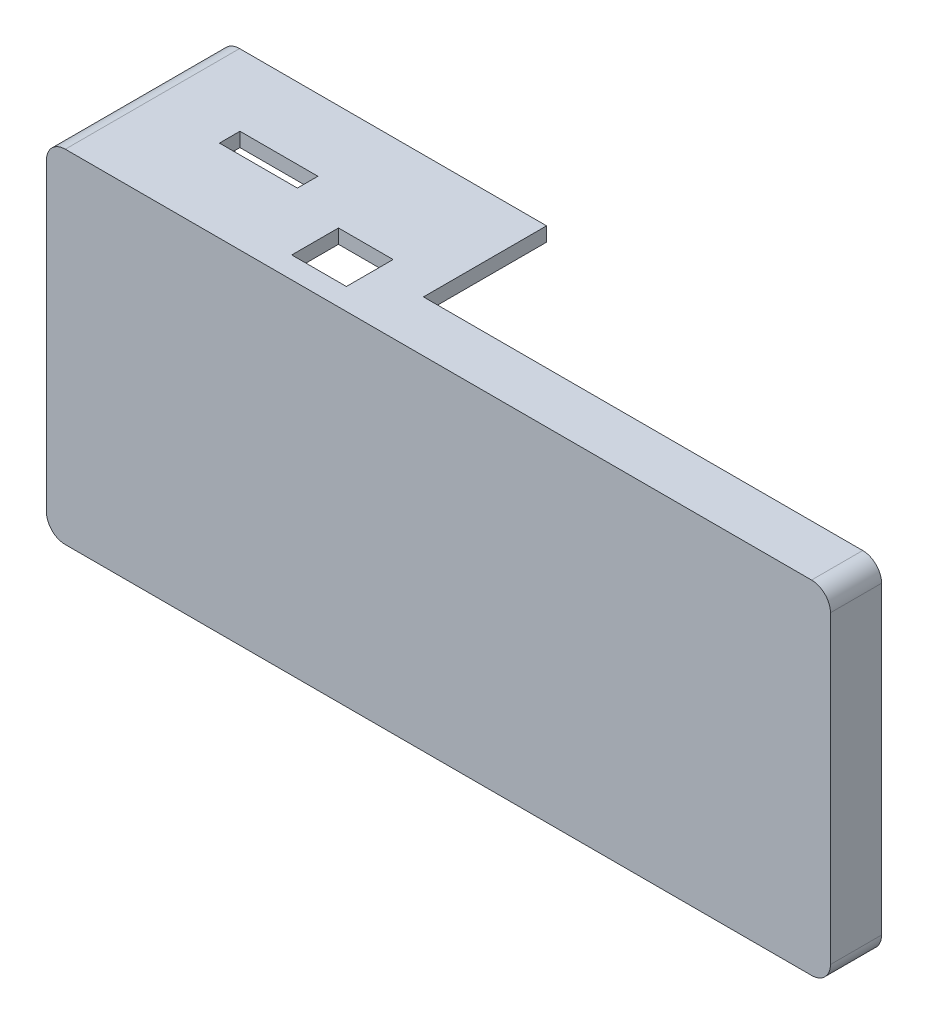
from build123d import *

# Parameters (mm, degrees)
ESQUISSE1_W                  = 160
ESQUISSE1_H                  = 66.5
BOSS_EXTRU_1_DEPTH           = 3
ESQUISSE3_W                  = 3
ESQUISSE3_H                  = 70.75
BOSS_EXTRU_2_DEPTH           = 33
ESQUISSE5_W                  = 166
ESQUISSE5_H                  = 33
ESQUISSE5_W_2                = 11.569169734
ESQUISSE5_H_2                = 9.894756015
BOSS_EXTRU_3_DEPTH           = 3
ENL_V_MAT_EXTRU_1_DEPTH      = 500
ENL_V_MAT_EXTRU_1_DEPTH_BACK = 13
ESQUISSE6_W                  = 33
ESQUISSE6_H                  = 1.25
CONG_2_R                     = 4
ESQUISSE7_W                  = 98.078954594
ESQUISSE7_H                  = 17.67
ENL_V_MAT_EXTRU_2_DEPTH      = 103
ESQUISSE8_R                  = 3.75
ENL_V_MAT_EXTRU_3_DEPTH      = 60
ESQUISSE9_W                  = 103.919717687
ESQUISSE9_H                  = 4.5
ENL_V_MAT_EXTRU_4_DEPTH      = 90
ESQUISSE11_W                 = 11.569169734
ESQUISSE11_H                 = 9.894756015
BOSS_EXTRU_4_DEPTH           = 3
D_PLACER_START               = -33.9
D_PLACER_LA_FACE2_DEPTH      = 3.9
ESQUISSE13_W                 = 16.502074088
ESQUISSE13_H                 = 4.3431
ENL_V_MAT_EXTRU_5_DEPTH      = 10
ESQUISSE15_W                 = 9.760998185
ESQUISSE15_H                 = 7
ENL_V_MAT_EXTRU_6_DEPTH      = 10


# Read off the part's stored shape, not the designer's step: Déplacer la face2
with BuildPart() as part:
    # Esquisse1 → Boss.-Extru.1 (new body)
    with BuildSketch(Plane.XY):
        Rectangle(ESQUISSE1_W, ESQUISSE1_H)
    extrude(amount=BOSS_EXTRU_1_DEPTH)

    # Esquisse3 → Boss.-Extru.2 (add)
    with BuildSketch(Plane.XY.offset(3)):
        with Locations((-81.5, -2.125)):
            Rectangle(ESQUISSE3_W, ESQUISSE3_H)
    boss_extru_2 = extrude(amount=-BOSS_EXTRU_2_DEPTH)

    # Symétrie1: Boss.-Extru.2 across plane
    add(boss_extru_2.mirror(Plane(origin=(0, 0, 0), x_dir=(0, 0, 1), z_dir=(1, 0, 0))))

    # Esquisse5 → Boss.-Extru.3 (add)
    with BuildSketch(Plane(origin=(0, 33.25, 0), x_dir=(1, 0, 0), z_dir=(0, 1, 0))):
        with Locations((0, 13.5)):
            Rectangle(ESQUISSE5_W, ESQUISSE5_H)
        with Locations((-29.852297111, 6.527378008)):
            Rectangle(ESQUISSE5_W_2, ESQUISSE5_H_2, mode=Mode.SUBTRACT)
    boss_extru_3 = extrude(amount=BOSS_EXTRU_3_DEPTH)

    # Symétrie2: Boss.-Extru.3 across plane
    add(boss_extru_3.mirror(Plane(origin=(0, 0, 0), x_dir=(0, 0, 1), z_dir=(0, -1, 0))))

    # Esquisse6 → Enlèv. mat.-Extru.1 (cut, two sides: drawn at the far end of the back side and taken through both)
    with BuildSketch(Plane.ZY.offset(-80).offset(-ENL_V_MAT_EXTRU_1_DEPTH_BACK)):
        with Locations((-13.5, -36.875)):
            Rectangle(ESQUISSE6_W, ESQUISSE6_H)
    extrude(amount=ENL_V_MAT_EXTRU_1_DEPTH + ENL_V_MAT_EXTRU_1_DEPTH_BACK, mode=Mode.SUBTRACT)

    # Congé2
    cong_2_edges = [part.edges().sort_by_distance(p)[0] for p in [
        (-83, -36.25, -13.5),
        (83, -36.25, -13.5),
        (-83, 36.25, -13.5),
        (83, 36.25, -13.5),
    ]]
    fillet(cong_2_edges, radius=CONG_2_R)

    # Esquisse7 → Enlèv. mat.-Extru.2 (cut)
    with BuildSketch(Plane(origin=(0, 36.25, 0), x_dir=(1, 0, 0), z_dir=(0, 1, 0))):
        with Locations((35.039477297, 21.165)):
            Rectangle(ESQUISSE7_W, ESQUISSE7_H)
    extrude(amount=-ENL_V_MAT_EXTRU_2_DEPTH, mode=Mode.SUBTRACT)

    # Esquisse8 → Enlèv. mat.-Extru.3 (cut)
    with BuildSketch(Plane.ZY.offset(83)):
        with Locations(Location((-23.114912873, -22.364838355, 0), (0, 0, 270))):
            Circle(ESQUISSE8_R)
        with Locations(Location((-23.117764577, 1.001660884, 0), (0, 0, 270))):
            Circle(ESQUISSE8_R)
    extrude(amount=-ENL_V_MAT_EXTRU_3_DEPTH, mode=Mode.SUBTRACT)

    # Esquisse9 → Enlèv. mat.-Extru.4 (cut)
    with BuildSketch(Plane(origin=(0, 36.25, 0), x_dir=(1, 0, 0), z_dir=(0, 1, 0))):
        with Locations((37.959858844, 10.08)):
            Rectangle(ESQUISSE9_W, ESQUISSE9_H)
    extrude(amount=-ENL_V_MAT_EXTRU_4_DEPTH, mode=Mode.SUBTRACT)

    # Esquisse11 → Boss.-Extru.4 (add)
    with BuildSketch(Plane.XZ.offset(36.25)):
        with Locations((-29.852297111, -6.527378008)):
            Rectangle(ESQUISSE11_W, ESQUISSE11_H)
    extrude(amount=-BOSS_EXTRU_4_DEPTH)

    # Déplacer la face2 outline → Déplacer la face2 (add)
    with BuildSketch(Plane.XY.offset(D_PLACER_START)):
        with BuildLine():
            ThreePointArc((-79, 36.25), (-81.828427125, 35.078427125), (-83, 32.25))
            Line((-83, 32.25), (-83, -32.25))
            ThreePointArc((-83, -32.25), (-81.828427125, -35.078427125), (-79, -36.25))
            Line((-79, -36.25), (-14, -36.25))
            Line((-14, -36.25), (-14, -33.25))
            Line((-14, -33.25), (-80, -33.25))
            Line((-80, -33.25), (-80, 33.25))
            Line((-80, 33.25), (-14, 33.25))
            Line((-14, 33.25), (-14, 36.25))
            Line((-14, 36.25), (-79, 36.25))
        make_face()
    extrude(amount=D_PLACER_LA_FACE2_DEPTH)

    # Esquisse13 → Enlèv. mat.-Extru.5 (cut)
    with BuildSketch(Plane(origin=(0, 36.25, 0), x_dir=(1, 0, 0), z_dir=(0, 1, 0))):
        with Locations((-55.551088515, 16.608317679)):
            Rectangle(ESQUISSE13_W, ESQUISSE13_H)
    extrude(amount=-ENL_V_MAT_EXTRU_5_DEPTH, mode=Mode.SUBTRACT)

    # Esquisse15 → Enlèv. mat.-Extru.6 (cut)
    with BuildSketch(Plane.XZ.offset(36.25)):
        with Locations((-66.304513779, -4.593344901)):
            Rectangle(ESQUISSE15_W, ESQUISSE15_H)
    extrude(amount=-ENL_V_MAT_EXTRU_6_DEPTH, mode=Mode.SUBTRACT)


solid = part.part
